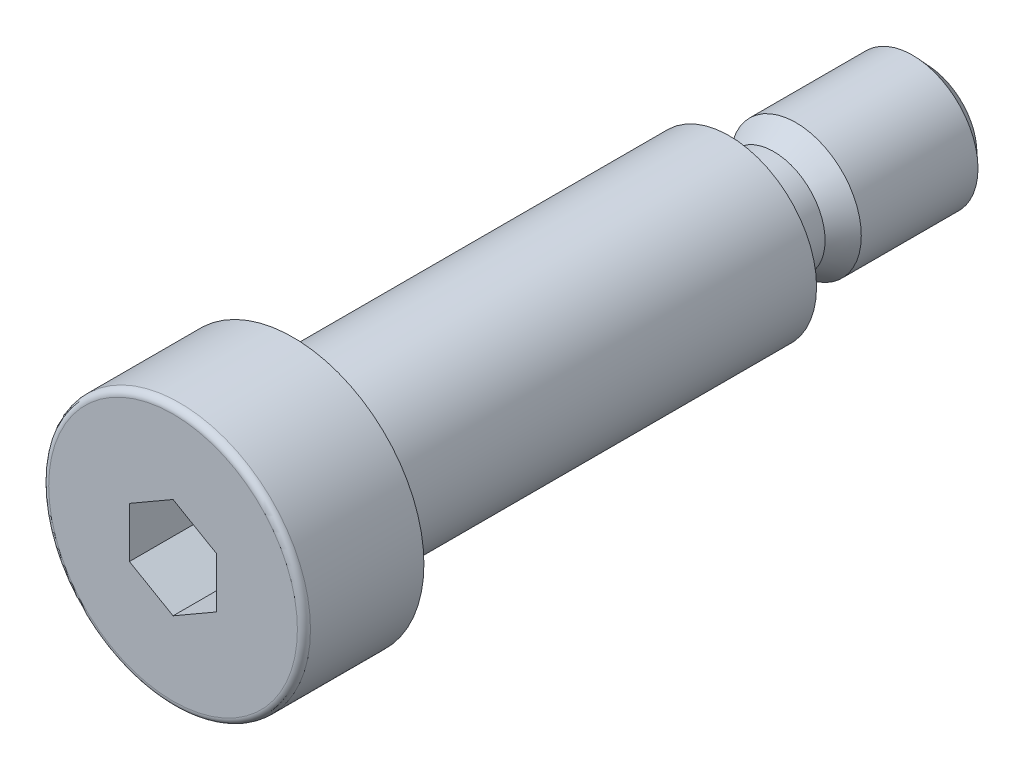
from build123d import *

# Parameters (mm, degrees)
WYTNIJ_WYCI_GNI_CIE1_DEPTH = 6.6
ZAOKR_GLENIE1_R            = 0.6


with BuildPart() as part:
    # Szkic1 → Obrót1 (revolve)
    with BuildSketch(Plane(origin=(0, 0, 0), x_dir=(1, 0, 0), z_dir=(0, 1, 0))):
        Polygon((0, 38), (-4.7, 38), (-6, 36.8), (-6, 26.1), (-4.7, 24.08), (-4.7, 20), (-8, 20), (-8, -20), (-12, -20), (-12, -31), (0, -31), align=None)
    revolve(axis=Axis((0, 0, 31), (0, 0, -1)))

    # Szkic2 → Wytnij-wyciągnięcie1 (cut)
    with BuildSketch(Plane.XY.offset(31)):
        Polygon((4, 2.309401077), (0, 4.618802154), (-4, 2.309401077), (-4, -2.309401077), (0, -4.618802154), (4, -2.309401077), align=None)
    extrude(amount=-WYTNIJ_WYCI_GNI_CIE1_DEPTH, mode=Mode.SUBTRACT)

    # Zaokrąglenie1
    zaokr_glenie1_edges = [part.edges().sort_by_distance(p)[0] for p in [
        (12, 0, 31),
    ]]
    fillet(zaokr_glenie1_edges, radius=ZAOKR_GLENIE1_R)


solid = part.part
